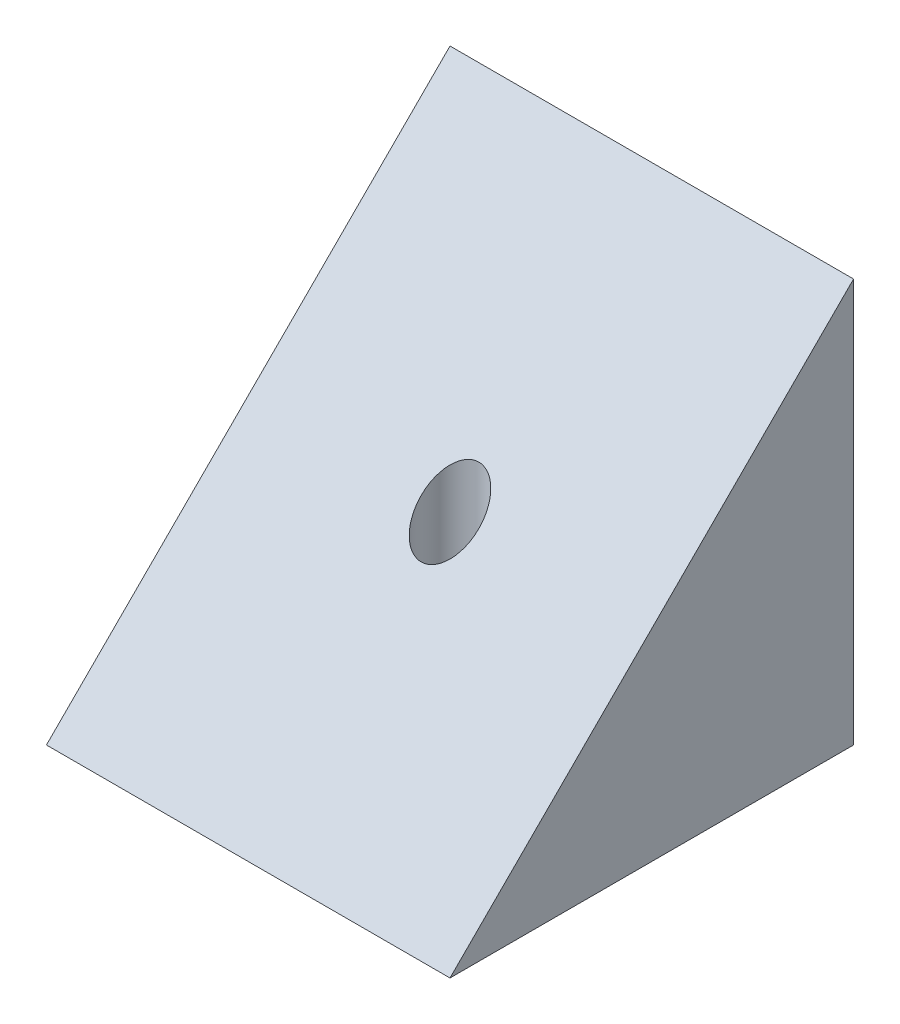
from build123d import *

# Parameters (mm, degrees)
ESQUISSE1_W             = 14
ESQUISSE1_H             = 14
EXTRUSION1_DEPTH        = 14
CHANFREIN1_SIZE         = 14
ESQUISSE2_R             = 1
ENL_V_MAT_EXTRU_1_DEPTH = 25.248711306


with BuildPart() as part:
    # Esquisse1 → Extrusion1 (new body)
    with BuildSketch(Plane.XY):
        with Locations((7, 7)):
            Rectangle(ESQUISSE1_W, ESQUISSE1_H)
    extrude(amount=EXTRUSION1_DEPTH)

    # Chanfrein1
    chanfrein1_edges = [part.edges().sort_by_distance(p)[0] for p in [
        (7, 14, 14),
    ]]
    chamfer(chanfrein1_edges, length=CHANFREIN1_SIZE - 0.0001)  # a hair under: the kernel refuses the full size

    # Esquisse2 → Enlèv. mat.-Extru.1 (cut, through all)
    with BuildSketch(Plane.XZ):
        with Locations(Location((7, 7, 0), (0, 0, 270))):
            Circle(ESQUISSE2_R)
    extrude(amount=-ENL_V_MAT_EXTRU_1_DEPTH, mode=Mode.SUBTRACT)


solid = part.part
